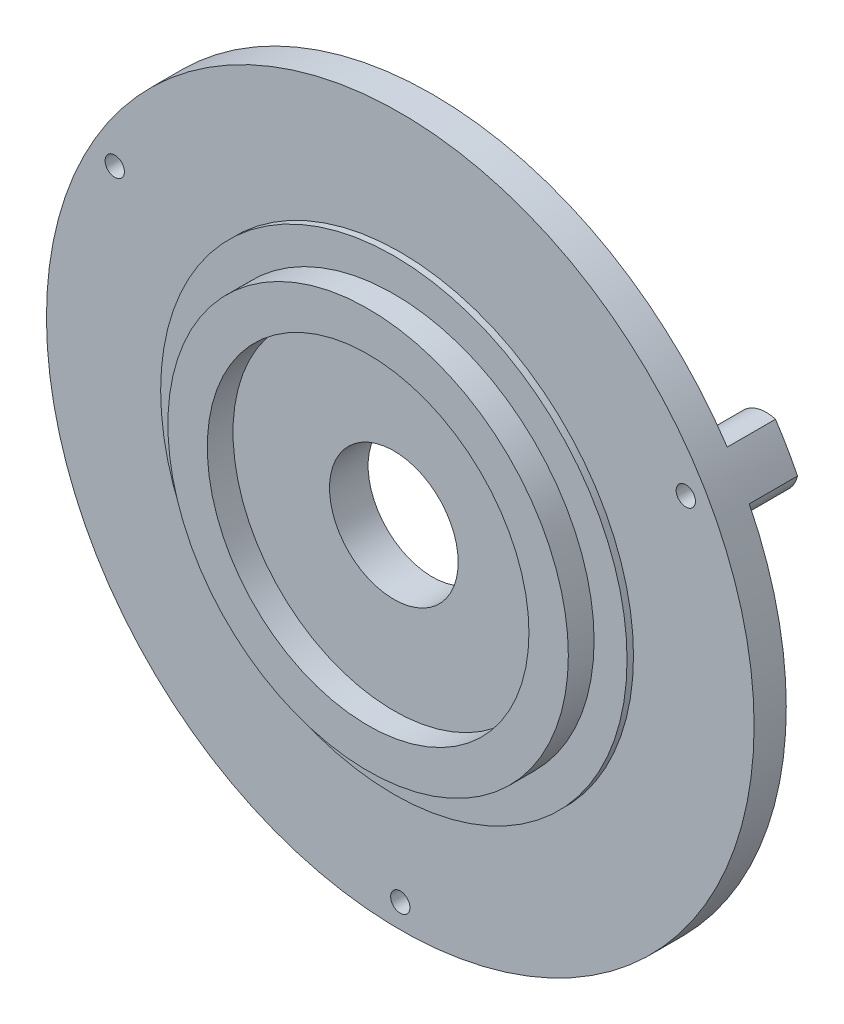
from build123d import *
from build123d.topology import SkipClean

# Parameters (mm, degrees)
SKETCH_1_R          = 22
EXTRUDE_1_DEPTH     = 2
SKETCH_2_R          = 12.45
SKETCH_2_R_2        = 10
EXTRUDE_2_DEPTH     = 2
SKETCH_3_R          = 4
CUT_EXTRUDE_1_DEPTH = 11
EXTRUDE_START       = 3
EXTRUDE_3_DEPTH     = 3
SKETCH_5_R          = 0.6
CUT_EXTRUDE_2_DEPTH = 16
EXTRUDE_START_2     = 0.4
SKETCH_6_R          = 14.5
SKETCH_6_R_2        = 4
EXTRUDE_4_DEPTH     = 0.4


with BuildPart() as part:
    # 草图1 → 凸台-拉伸1 (new body)
    with BuildSketch(Plane.XY):
        Circle(SKETCH_1_R)
    extrude(amount=EXTRUDE_1_DEPTH)

    # 草图2 → 凸台-拉伸2 (add)
    with BuildSketch(Plane.XY.offset(2)):
        Circle(SKETCH_2_R)
        Circle(SKETCH_2_R_2, mode=Mode.SUBTRACT)
    extrude(amount=EXTRUDE_2_DEPTH)

    # 草图3 → 切除-拉伸1 (cut)
    with BuildSketch(Plane.XY.offset(2)):
        Circle(SKETCH_3_R)
    extrude(amount=-CUT_EXTRUDE_1_DEPTH, mode=Mode.SUBTRACT)

    # 草图4 → 凸台-拉伸3 (add)
    with SkipClean():  # the faces are left unmerged after this step: merging them gives an invalid solid
        with BuildSketch(Plane(origin=(0, 0, 0), x_dir=(-1, 0, 0), z_dir=(0, 0, -1)).offset(EXTRUDE_START)):
            with BuildLine():
                ThreePointArc((1.369754339, -21.957317073), (0, -18.5), (-1.369754339, -21.957317073))
                ThreePointArc((-1.369754339, -21.957317073), (0, -22), (1.369754339, -21.957317073))
            make_face()
            with BuildLine():
                ThreePointArc((-19.700471554, 9.792416482), (-16.02146997, 9.25), (-18.330717215, 12.164900591))
                ThreePointArc((-18.330717215, 12.164900591), (-19.052558883, 11), (-19.700471554, 9.792416482))
            make_face()
            with BuildLine():
                ThreePointArc((18.330717215, 12.164900591), (16.02146997, 9.25), (19.700471554, 9.792416482))
                ThreePointArc((19.700471554, 9.792416482), (19.052558883, 11), (18.330717215, 12.164900591))
            make_face()
        extrude(amount=-EXTRUDE_3_DEPTH)

    # 草图5 → 切除-拉伸2 (cut)
    with SkipClean():  # the faces are left unmerged after this step: merging them gives an invalid solid
        with BuildSketch(Plane(origin=(0, 0, -3), x_dir=(-1, 0, 0), z_dir=(0, 0, -1))):
            with Locations((0, -20.5)):
                Circle(SKETCH_5_R)
            with Locations((-17.753520778, 10.25)):
                Circle(SKETCH_5_R)
            with Locations((17.753520778, 10.25)):
                Circle(SKETCH_5_R)
        extrude(amount=-CUT_EXTRUDE_2_DEPTH, mode=Mode.SUBTRACT)

    # 草图6 → 凸台-拉伸4 (add)
    with SkipClean():  # the faces are left unmerged after this step: merging them gives an invalid solid
        with BuildSketch(Plane.XY.offset(2).offset(EXTRUDE_START_2)):
            Circle(SKETCH_6_R)
            Circle(SKETCH_6_R_2, mode=Mode.SUBTRACT)
        extrude(amount=-EXTRUDE_4_DEPTH)


solid = part.part
